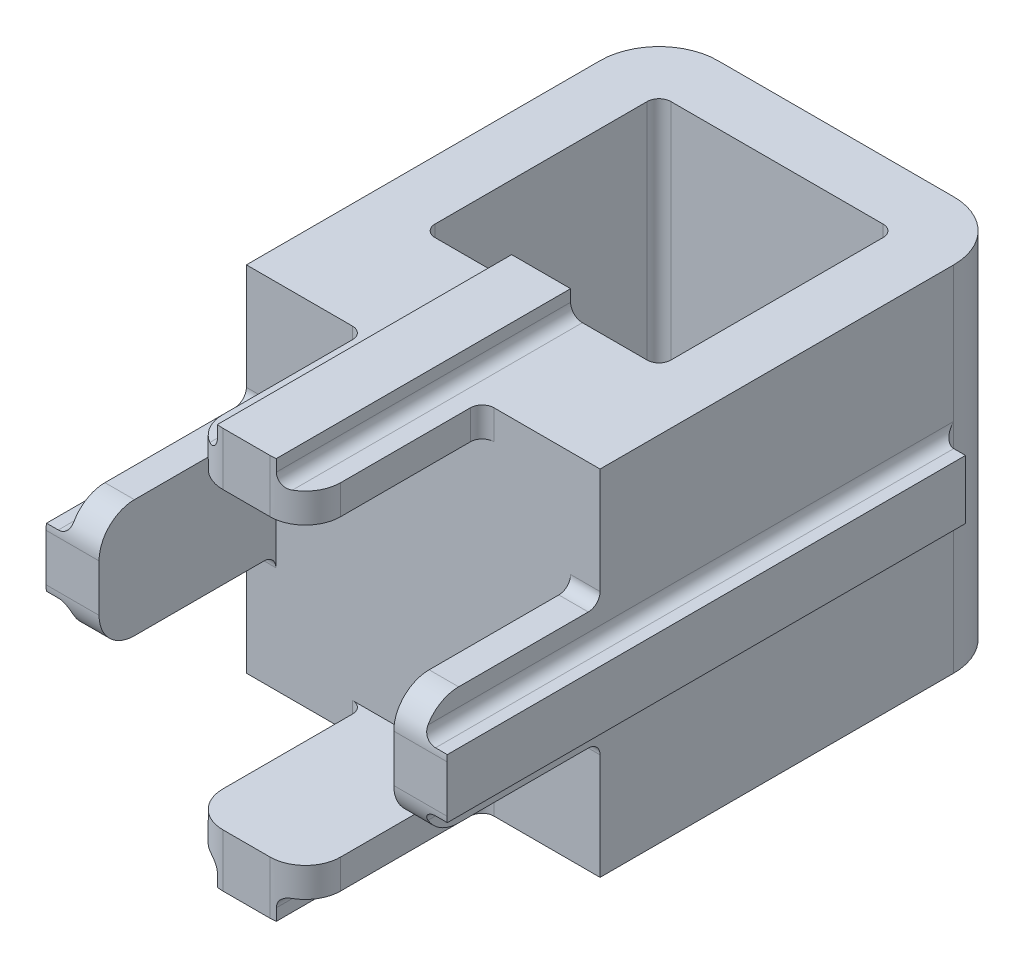
from build123d import *

# Parameters (mm, degrees)
SKETCH1_W           = 30
SKETCH1_H           = 30
BOSS_EXTRUDE1_DEPTH = 35
SKETCH2_W           = 20
SKETCH2_H           = 20
CUT_EXTRUDE1_DEPTH  = 20
SKETCH3_W           = 10
SKETCH3_H           = 2.5
SKETCH3_W_2         = 2.5
SKETCH3_H_2         = 10
BOSS_EXTRUDE2_DEPTH = 15
FILLET3_R           = 5
SKETCH4_W           = 44
SKETCH4_H           = 5
BOSS_EXTRUDE3_DEPTH = 2
CIRPATTERN1_COUNT   = 3
CIRPATTERN1_ANGLE   = 180
SKETCH5_W           = 5
SKETCH5_H           = 25
BOSS_EXTRUDE4_DEPTH = 2
FILLET1_R           = 1
FILLET2_R           = 3


with BuildPart() as part:
    # Sketch1 → Boss-Extrude1 (new body)
    with BuildSketch(Plane.XY):
        Rectangle(SKETCH1_W, SKETCH1_H)
    extrude(amount=BOSS_EXTRUDE1_DEPTH)

    # Sketch2 → Cut-Extrude1 (cut)
    with BuildSketch(Plane(origin=(0, 15, 0), x_dir=(1, 0, 0), z_dir=(0, 1, 0))):
        with Locations((0, -15)):
            Rectangle(SKETCH2_W, SKETCH2_H)
    extrude(amount=-CUT_EXTRUDE1_DEPTH, mode=Mode.SUBTRACT)

    # Sketch3 → Boss-Extrude2 (add)
    with BuildSketch(Plane.XY.offset(35)):
        with Locations((0, 13.75)):
            Rectangle(SKETCH3_W, SKETCH3_H)
        with Locations((13.75, 0)):
            Rectangle(SKETCH3_W_2, SKETCH3_H_2)
        with Locations((0, -13.75)):
            Rectangle(SKETCH3_W, SKETCH3_H)
        with Locations((-13.75, 0)):
            Rectangle(SKETCH3_W_2, SKETCH3_H_2)
    extrude(amount=BOSS_EXTRUDE2_DEPTH)

    # Fillet3
    fillet3_edges = [part.edges().sort_by_distance(p)[0] for p in [
        (15, 0, 0),
        (-15, 0, 0),
    ]]
    fillet(fillet3_edges, radius=FILLET3_R)

    # Sketch4 → Boss-Extrude3 (add)
    with BuildSketch(Plane(origin=(15, 0, 0), x_dir=(0, 0, -1), z_dir=(1, 0, 0))):
        with Locations((-28, 0)):
            Rectangle(SKETCH4_W, SKETCH4_H)
    boss_extrude3 = extrude(amount=BOSS_EXTRUDE3_DEPTH)

    # CirPattern1: Boss-Extrude3 ×3 about axis
    cirpattern1_axis = Axis((0, 0, 0), (0, 0, -1))
    for i in range(1, CIRPATTERN1_COUNT):
        add(boss_extrude3.rotate(cirpattern1_axis, i * CIRPATTERN1_ANGLE / (CIRPATTERN1_COUNT - 1)))

    # Sketch5 → Boss-Extrude4 (add)
    with BuildSketch(Plane(origin=(0, 15, 0), x_dir=(1, 0, 0), z_dir=(0, 1, 0))):
        with Locations((0, -37.5)):
            Rectangle(SKETCH5_W, SKETCH5_H)
    extrude(amount=BOSS_EXTRUDE4_DEPTH)

    # Fillet1
    fillet1_edges = [part.edges().sort_by_distance(p)[0] for p in [
        (-2.5, -15, 28),
        (0, -15, 6),
        (2.5, -15, 28),
        (-15, 2.5, 28),
        (-15, 0, 6),
        (-15, -2.5, 28),
        (-2.5, 15, 37.5),
        (2.5, 15, 37.5),
        (-10, 5, 25),
        (-10, 5, 5),
        (10, 5, 5),
        (10, 5, 25),
        (-5, 13.75, 35),
        (5, 13.75, 35),
        (13.75, 5, 35),
        (13.75, -5, 35),
        (5, -13.75, 35),
        (-5, -13.75, 35),
        (-13.75, -5, 35),
        (-13.75, 5, 35),
        (15, -2.5, 28),
        (15, 0, 6),
        (15, 2.5, 28),
    ]]
    fillet(fillet1_edges, radius=FILLET1_R - 0.0001)  # a hair under: the kernel refuses the full size

    # Fillet2
    fillet2_edges = [part.edges().sort_by_distance(p)[0] for p in [
        (-13.75, 5, 50),
        (-13.75, -5, 50),
        (5, -13.75, 50),
        (-5, -13.75, 50),
        (13.75, -5, 50),
        (13.75, 5, 50),
        (5, 13.75, 50),
        (-5, 13.75, 50),
    ]]
    fillet(fillet2_edges, radius=FILLET2_R)


solid = part.part
